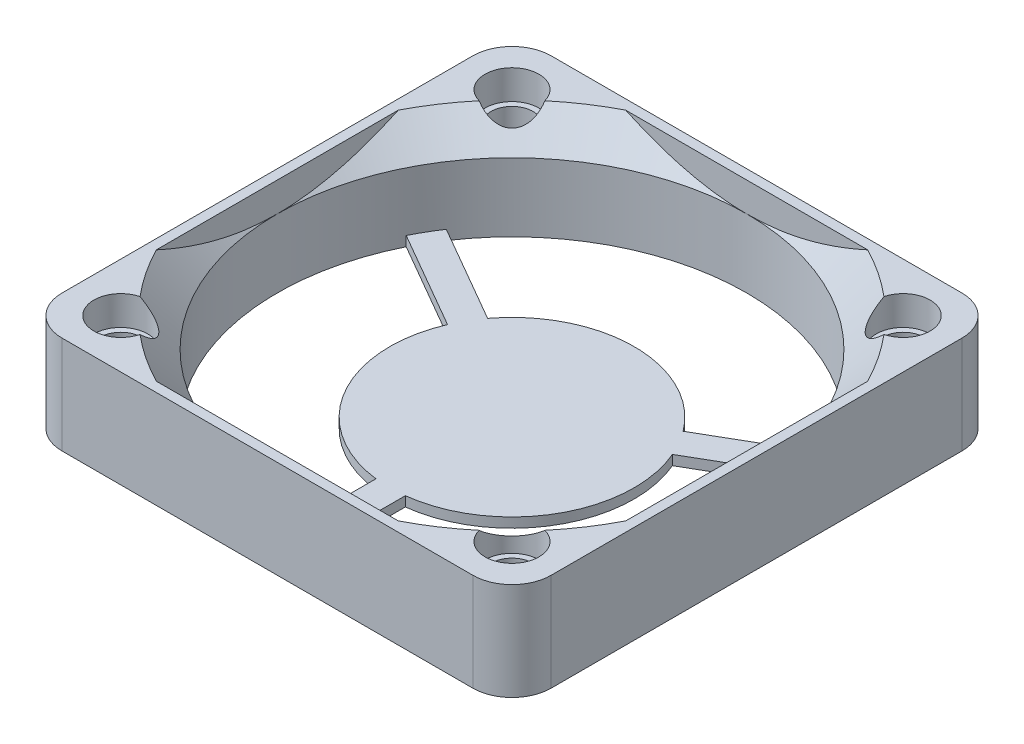
from build123d import *

# Parameters (mm, degrees)
SKETCH1_W           = 50
SKETCH1_H           = 50
SKETCH1_R           = 24
BOSS_EXTRUDE1_DEPTH = 10
CHAMFER1_SIZE       = 3
BOSS_EXTRUDE2_START = -2.999999
SKETCH4_W           = 50
SKETCH4_H           = 50
SKETCH4_W_2         = 48
SKETCH4_H_2         = 48
BOSS_EXTRUDE2_DEPTH = 2.999999
SKETCH5_R           = 2.75
CUT_EXTRUDE1_DEPTH  = 3
FILLET1_R           = 4
SKETCH6_R           = 12.5
BOSS_EXTRUDE5_DEPTH = 1
SKETCH7_R           = 2.15
CUT_EXTRUDE2_DEPTH  = 21
SKETCH9_W           = 3
SKETCH9_H           = 24
BOSS_EXTRUDE6_DEPTH = 1
CIRPATTERN1_COUNT   = 3


with BuildPart() as part:
    # Sketch1 → Boss-Extrude1 (new body)
    with BuildSketch(Plane(origin=(0, 0, 0), x_dir=(1, 0, 0), z_dir=(0, 1, 0))):
        Rectangle(SKETCH1_W, SKETCH1_H)
        with Locations(Location((0, 0, 0), (0, 0, 270))):
            Circle(SKETCH1_R, mode=Mode.SUBTRACT)
    extrude(amount=BOSS_EXTRUDE1_DEPTH)

    # Chamfer1
    # the kernel refuses this chamfer: 3 mm, written as the material it takes off along each edge
    with BuildSketch(Plane(origin=(0, 10, 0), x_dir=(0, 0, 1), z_dir=(-1, 0, 0))) as chamfer1_piece_1:
        Polygon((24, -CHAMFER1_SIZE), (24 + CHAMFER1_SIZE, 0), (24, 0), align=None)
    revolve(axis=Axis((0, 10, 0), (0, 1, 0)), mode=Mode.SUBTRACT)

    # Sketch4 → Boss-Extrude2 (add)
    with BuildSketch(Plane(origin=(0, 10, 0), x_dir=(1, 0, 0), z_dir=(0, 1, 0)).offset(BOSS_EXTRUDE2_START)):
        Rectangle(SKETCH4_W, SKETCH4_H)
        Rectangle(SKETCH4_W_2, SKETCH4_H_2, mode=Mode.SUBTRACT)
    extrude(amount=BOSS_EXTRUDE2_DEPTH)

    # Sketch5 → Cut-Extrude1 (cut)
    with BuildSketch(Plane(origin=(0, 10, 0), x_dir=(1, 0, 0), z_dir=(0, 1, 0))):
        with Locations(Location((-20, 20, 0), (0, 0, 270))):
            Circle(SKETCH5_R)
        with Locations(Location((20, 20, 0), (0, 0, 270))):
            Circle(SKETCH5_R)
        with Locations(Location((20, -20, 0), (0, 0, 270))):
            Circle(SKETCH5_R)
        with Locations(Location((-20, -20, 0), (0, 0, 270))):
            Circle(SKETCH5_R)
    extrude(amount=-CUT_EXTRUDE1_DEPTH, mode=Mode.SUBTRACT)

    # Fillet1
    fillet1_edges = [part.edges().sort_by_distance(p)[0] for p in [
        (-25, 5, -25),
        (25, 5, -25),
        (25, 5, 25),
        (-25, 5, 25),
    ]]
    fillet(fillet1_edges, radius=FILLET1_R)

    # Sketch7 → Cut-Extrude2 (cut)
    with BuildSketch(Plane(origin=(0, 7, 0), x_dir=(1, 0, 0), z_dir=(0, 1, 0))):
        with Locations(Location((-20, -20, 0), (0, 0, 270))):
            Circle(SKETCH7_R)
        with Locations(Location((-20, 20, 0), (0, 0, 270))):
            Circle(SKETCH7_R)
        with Locations(Location((20, 20, 0), (0, 0, 270))):
            Circle(SKETCH7_R)
        with Locations(Location((20, -20, 0), (0, 0, 270))):
            Circle(SKETCH7_R)
    extrude(amount=-CUT_EXTRUDE2_DEPTH, mode=Mode.SUBTRACT)



with BuildPart() as body_2:
    # Sketch6 → Boss-Extrude5 (new body)
    with BuildSketch(Plane(origin=(0, 0, 0), x_dir=(1, 0, 0), z_dir=(0, 1, 0))):
        with Locations(Location((0, 0, 0), (0, 0, 270))):
            Circle(SKETCH6_R)
    extrude(amount=BOSS_EXTRUDE5_DEPTH)


with BuildPart() as part_1:
    add(part.part)

    add(body_2.part)  # Boss-Extrude6 merges body 2
    # Sketch9 → Boss-Extrude6 (add)
    with BuildSketch(Plane.XZ):
        with Locations((0, 12.5)):
            Rectangle(SKETCH9_W, SKETCH9_H)
    boss_extrude6 = extrude(amount=-BOSS_EXTRUDE6_DEPTH)

    # CirPattern1: Boss-Extrude6 ×3 about axis
    cirpattern1_axis = Axis((0, 0, 0), (0, 1, 0))
    for i in range(1, CIRPATTERN1_COUNT):
        add(boss_extrude6.rotate(cirpattern1_axis, i * 360 / CIRPATTERN1_COUNT))


solid = part_1.part
